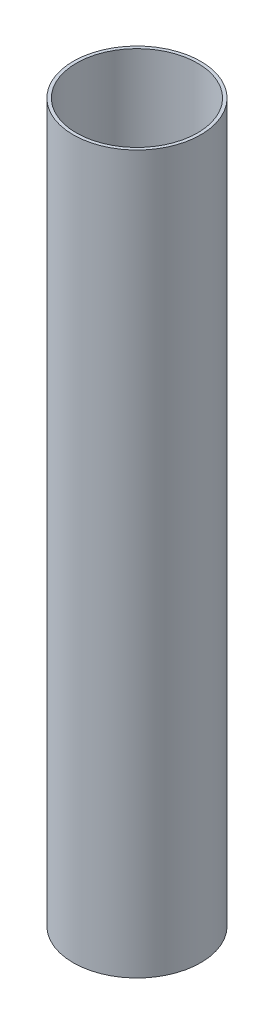
from build123d import *

# Parameters (mm, degrees)
SKETCH1_R           = 40
SKETCH1_R_2         = 38
BOSS_EXTRUDE1_DEPTH = 450


with BuildPart() as part:
    # Sketch1 → Boss-Extrude1 (new body)
    with BuildSketch(Plane(origin=(0, 0, 0), x_dir=(1, 0, 0), z_dir=(0, 1, 0))):
        Circle(SKETCH1_R)
        Circle(SKETCH1_R_2, mode=Mode.SUBTRACT)
    extrude(amount=BOSS_EXTRUDE1_DEPTH)


solid = part.part
